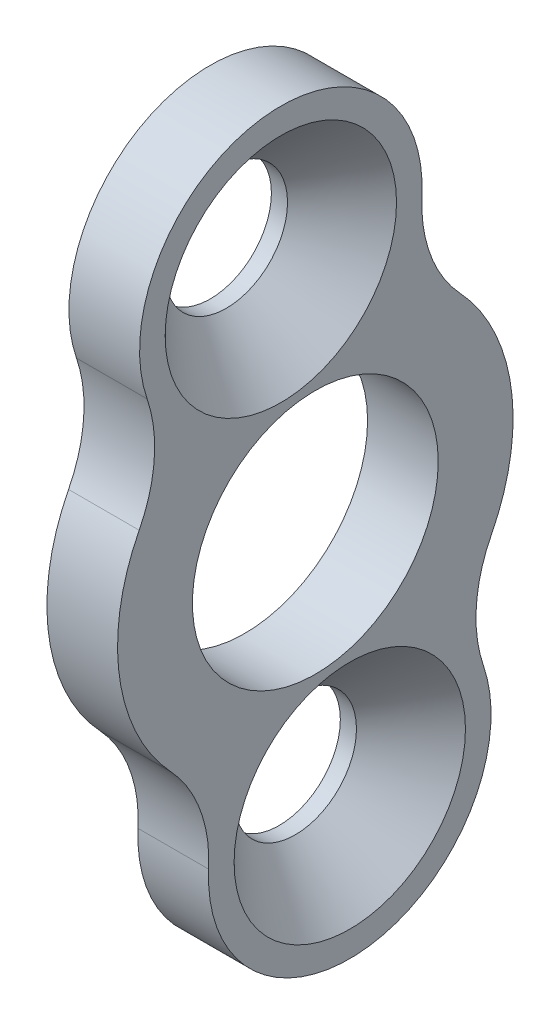
from build123d import *

# Parameters (mm, degrees)
SKETCH1_R                                      = 5.5245
BOSS_EXTRUDE1_DEPTH                            = 3.175
CSK_FOR_M5_FLAT_HEAD_MACHINE_SCREW1_AT_2_COUNT = 2
CSK_FOR_M5_FLAT_HEAD_MACHINE_SCREW1_AT_2_PITCH = 22.2635


with BuildPart() as part:
    # Sketch1 → Boss-Extrude1 (new body)
    with BuildSketch(Plane(origin=(0, 0, 0), x_dir=(0, 0, -1), z_dir=(1, 0, 0))):
        with BuildLine():
            ThreePointArc((-7.560707125, 8.977746755), (-2.432989358, 17.311618811), (4.793215777, 10.713977392))
            ThreePointArc((4.793215777, 10.713977392), (5.173620215, 8.219030978), (6.495808503, 6.069313955))
            ThreePointArc((6.495808503, 6.069313955), (8.803483131, 1.237248868), (7.917101549, -4.043711546))
            ThreePointArc((7.917101549, -4.043711546), (7.238674909, -6.474596661), (7.560707125, -8.977746755))
            ThreePointArc((7.560707125, -8.977746755), (2.432989358, -17.311618811), (-4.793215777, -10.713977392))
            ThreePointArc((-4.793215777, -10.713977392), (-5.173620215, -8.219030978), (-6.495808503, -6.069313955))
            ThreePointArc((-6.495808503, -6.069313955), (-8.803483131, -1.237248868), (-7.917101549, 4.043711546))
            ThreePointArc((-7.917101549, 4.043711546), (-7.238674909, 6.474596661), (-7.560707125, 8.977746755))
        make_face()
        Circle(SKETCH1_R, mode=Mode.SUBTRACT)
    extrude(amount=BOSS_EXTRUDE1_DEPTH)

    # Sketch3 → CSK for M5 Flat Head Machine Screw1 (revolve, cut)
    with BuildSketch(Plane(origin=(3.175, 11.023416574, 1.549240167), x_dir=(0, 0, -1), z_dir=(0, 1, 0))):
        Polygon((0, 0), (0, 3.175), (2.75, 3.175), (2.75, 2.45), (5.2, 0), align=None)
    csk_for_m5_flat_head_machine_screw1 = revolve(axis=Axis((9.525, 11.023416574, 1.549240167), (-1, 0, 0)), mode=Mode.SUBTRACT)

    # CSK for M5 Flat Head Machine Screw1 at 2: CSK for M5 Flat Head Machine Screw1 ×2
    with Locations(*[Vector(0, -0.9902680687415713, -0.13917310096005903) * (i * CSK_FOR_M5_FLAT_HEAD_MACHINE_SCREW1_AT_2_PITCH) for i in range(1, CSK_FOR_M5_FLAT_HEAD_MACHINE_SCREW1_AT_2_COUNT)]):
        add(csk_for_m5_flat_head_machine_screw1, mode=Mode.SUBTRACT)


solid = part.part
